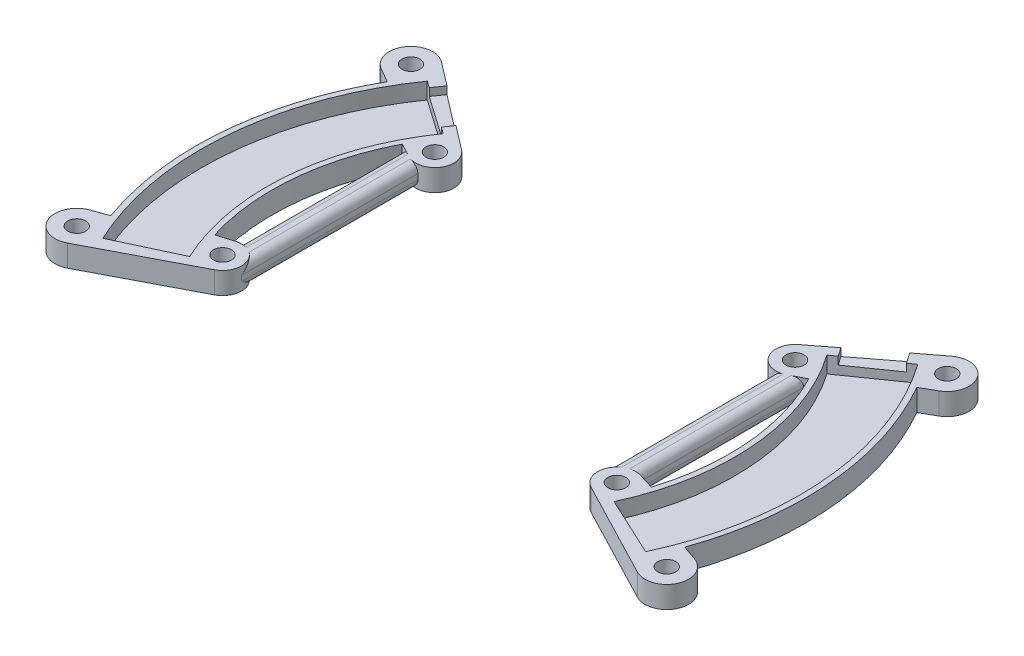
from build123d import *

# Parameters (mm, degrees)
SKETCH1_R                    = 1.65
BOSS_EXTRUDE1_DEPTH          = 4
CUT_REVOLVE1_ANGLE           = 25
CUT_REVOLVE1_OTHER_WAY_ANGLE = 35
FILLET2_R                    = 1.5
SKETCH8_R                    = 3.5
SKETCH8_R_2                  = 1.65
BOSS_EXTRUDE2_DEPTH          = 4
CUT_REVOLVE2_ANGLE           = 25
CUT_REVOLVE2_OTHER_WAY_ANGLE = 35
SKETCH11_W                   = 9
SKETCH11_H                   = 1.4
CUT_EXTRUDE1_DEPTH           = 10


with BuildPart() as part:
    # Sketch1 → Boss-Extrude1 (new body)
    with BuildSketch(Plane(origin=(0, 0, 0), x_dir=(1, 0, 0), z_dir=(0, 1, 0))):
        with BuildLine():
            Line((48.622551971, 27.782142463), (51.227331541, 29.270471524))
            ThreePointArc((51.227331541, 29.270471524), (52.573747837, 34.958325768), (46.807847077, 35.916924312))
            Line((46.807847077, 35.916924312), (30.940780271, 23.741695731))
            ThreePointArc((30.940780271, 23.741695731), (29.703391092, 20.01300787), (32.70954264, 17.483719824))
            Line((32.70954264, 17.483719824), (32.70954264, -14.903658))
            ThreePointArc((32.70954264, -14.903658), (33.217351093, -16.719364404), (34.593422494, -18.008195916))
            Line((34.593422494, -18.008195916), (52.333639158, -27.243168181))
            ThreePointArc((52.333639158, -27.243168181), (57.845484039, -25.297894743), (55.531837307, -19.930254522))
            Line((55.531837307, -19.930254522), (52.708184562, -18.91685175))
            ThreePointArc((52.708184562, -18.91685175), (55.786903093, 4.880721594), (48.622551971, 27.782142463))
        make_face()
        with BuildLine():
            Line((36.70954264, 18.90148346), (37.340861788, 19.226545216))
            ThreePointArc((37.340861788, 19.226545216), (41.84017732, 3.660541195), (40.112224732, -12.450278191))
            Line((40.112224732, -12.450278191), (37.247065823, -11.560972606))
            ThreePointArc((37.247065823, -11.560972606), (36.980697527, -11.48966911), (36.70954264, -11.439556385))
            Line((36.70954264, -11.439556385), (36.70954264, 18.90148346))
        make_face(mode=Mode.SUBTRACT)
        with Locations(Location((49.242892793, 32.74351095, 0), (0, 0, 270))):
            Circle(SKETCH1_R, mode=Mode.SUBTRACT)
        with Locations(Location((54.18063361, -23.695124848, 0), (0, 0, 270))):
            Circle(SKETCH1_R, mode=Mode.SUBTRACT)
        with Locations(Location((33.071445273, 20.96495904, 0), (0, 0, 270))):
            Circle(SKETCH1_R, mode=Mode.SUBTRACT)
        with Locations(Location((36.20954264, -14.903658, 0), (0, 0, 270))):
            Circle(SKETCH1_R, mode=Mode.SUBTRACT)
    extrude(amount=BOSS_EXTRUDE1_DEPTH)

    # Sketch7 → Cut-Revolve1 (revolve, cut)
    with BuildSketch(Plane.XY):
        Polygon((43, 4), (43, 3), (44, 3), (44, 1), (54, 1), (54, 3), (55, 3), (55, 4), align=None)
    revolve(axis=Axis((0, 4.2, 0), (0, -1, 0)), revolution_arc=CUT_REVOLVE1_ANGLE, mode=Mode.SUBTRACT)

    # Sketch7 → Cut-Revolve1 other way (revolve, cut)
    with BuildSketch(Plane.XY):
        Polygon((43, 4), (43, 3), (44, 3), (44, 1), (54, 1), (54, 3), (55, 3), (55, 4), align=None)
    revolve(axis=Axis((0, 4.2, 0), (0, 1, 0)), revolution_arc=CUT_REVOLVE1_OTHER_WAY_ANGLE, mode=Mode.SUBTRACT)

    # Fillet2
    # the kernel refuses this fillet: 1.5 mm, written as the material it takes off along each edge
    with BuildSketch(Plane(origin=(36.70954264, 4, 15.189556385), x_dir=(-1, 0, 0), z_dir=(0, 0, -1))) as fillet2_piece_1_section:
        with BuildLine():
            CenterArc((FILLET2_R, -FILLET2_R), FILLET2_R, 90, 90)
            Line((0, -FILLET2_R), (0, 0))
            Line((0, 0), (FILLET2_R, 0))
        make_face()
    fillet2_piece_1 = extrude(amount=37.841039844, mode=Mode.PRIVATE)
    fillet2_piece_1 = split(fillet2_piece_1, bisect_by=Plane(origin=(30.232466852, 3.688029103, -15.566483019), z_dir=(0.45777488610297684, 0, 0.8890681378012636)), keep=Keep.TOP, mode=Mode.PRIVATE)
    fillet2_piece_1 = fillet2_piece_1 - Plane(origin=(36.20954264, 3.688029103, 14.903658), x_dir=(0.29643519501757987, 0, -0.9550529698162765), z_dir=(0, -1, 0)) * Cylinder(3.5, 82, mode=Mode.PRIVATE)
    add(fillet2_piece_1, mode=Mode.SUBTRACT)
    with BuildSketch(Plane(origin=(32.70954264, 0, -21.233719824), x_dir=(0, 1, 0), z_dir=(0, 0, 1))) as fillet2_piece_2_section:
        with BuildLine():
            CenterArc((FILLET2_R, -FILLET2_R), FILLET2_R, 90, 90)
            Line((0, -FILLET2_R), (0, 0))
            Line((0, 0), (FILLET2_R, 0))
        make_face()
    fillet2_piece_2 = extrude(amount=39.887377824, mode=Mode.PRIVATE)
    fillet2_piece_2 = fillet2_piece_2 - Plane(origin=(33.071445273, 0.338493071, -20.96495904), x_dir=(-0.6087614290087169, 0, -0.793353340291238), z_dir=(0, -1, 0)) * Cylinder(3.5, 86, mode=Mode.PRIVATE)
    add(fillet2_piece_2, mode=Mode.SUBTRACT)
    with BuildSketch(Plane(origin=(36.70954264, 0, 15.189556385), x_dir=(0, 1, 0), z_dir=(0, 0, -1))) as fillet2_piece_3_section:
        with BuildLine():
            CenterArc((FILLET2_R, -FILLET2_R), FILLET2_R, 90, 90)
            Line((0, -FILLET2_R), (0, 0))
            Line((0, 0), (FILLET2_R, 0))
        make_face()
    fillet2_piece_3 = extrude(amount=37.841039844, mode=Mode.PRIVATE)
    fillet2_piece_3 = split(fillet2_piece_3, bisect_by=Plane(origin=(30.240721188, 0.335881602, -15.570733118), z_dir=(0.45777488610297684, 0, 0.8890681378012636)), keep=Keep.TOP, mode=Mode.PRIVATE)
    fillet2_piece_3 = fillet2_piece_3 - Plane(origin=(36.20954264, 0.335881602, 14.903658), x_dir=(0.29643519501757987, 0, -0.9550529698162765), z_dir=(0, -1, 0)) * Cylinder(3.5, 82, mode=Mode.PRIVATE)
    add(fillet2_piece_3, mode=Mode.SUBTRACT)
    with BuildSketch(Plane(origin=(32.70954264, 4, -21.233719824), x_dir=(1, 0, 0), z_dir=(0, 0, 1))) as fillet2_piece_4_section:
        with BuildLine():
            CenterArc((FILLET2_R, -FILLET2_R), FILLET2_R, 90, 90)
            Line((0, -FILLET2_R), (0, 0))
            Line((0, 0), (FILLET2_R, 0))
        make_face()
    fillet2_piece_4 = extrude(amount=39.887377824, mode=Mode.PRIVATE)
    fillet2_piece_4 = fillet2_piece_4 - Plane(origin=(33.071445273, 3.661506912, -20.96495904), x_dir=(-0.6087614290087169, 0, -0.793353340291238), z_dir=(0, -1, 0)) * Cylinder(3.5, 86, mode=Mode.PRIVATE)
    add(fillet2_piece_4, mode=Mode.SUBTRACT)

    # Sketch8 → Boss-Extrude2 (add)
    with BuildSketch(Plane(origin=(0, 0, 0), x_dir=(1, 0, 0), z_dir=(0, 1, 0))):
        with Locations((36.20954264, -14.903658)):
            Circle(SKETCH8_R)
        with Locations(Location((36.20954264, -14.903658, 0), (0, 0, 270))):
            Circle(SKETCH8_R_2, mode=Mode.SUBTRACT)
    extrude(amount=BOSS_EXTRUDE2_DEPTH)

    # Sketch9 → Cut-Revolve2 (revolve, cut)
    with BuildSketch(Plane.XY):
        Polygon((43, 4), (43, 3), (43, 1), (44, 1), (54, 1), (55, 1), (55, 3), (55, 4), align=None)
    revolve(axis=Axis((0, 4.2, 0), (0, -1, 0)), revolution_arc=CUT_REVOLVE2_ANGLE, mode=Mode.SUBTRACT)

    # Sketch9 → Cut-Revolve2 other way (revolve, cut)
    with BuildSketch(Plane.XY):
        Polygon((43, 4), (43, 3), (43, 1), (44, 1), (54, 1), (55, 1), (55, 3), (55, 4), align=None)
    revolve(axis=Axis((0, 4.2, 0), (0, 1, 0)), revolution_arc=CUT_REVOLVE2_OTHER_WAY_ANGLE, mode=Mode.SUBTRACT)

    # Sketch11 → Cut-Extrude1 (cut)
    with BuildSketch(Plane(origin=(0, 0, 0), x_dir=(0.819152044288991, 0, -0.5735764363510474), z_dir=(0.5735764363510474, 0, 0.819152044288991))):
        with Locations((49, 3.3)):
            Rectangle(SKETCH11_W, SKETCH11_H)
    extrude(amount=-CUT_EXTRUDE1_DEPTH, mode=Mode.SUBTRACT)


with BuildPart() as body_2:
    # Mirror2: mirrored copy
    add(part.part.mirror(Plane(origin=(0, 0, 0), x_dir=(0, 0, 1), z_dir=(1, 0, 0))))


solid = Compound([part.part, body_2.part])
